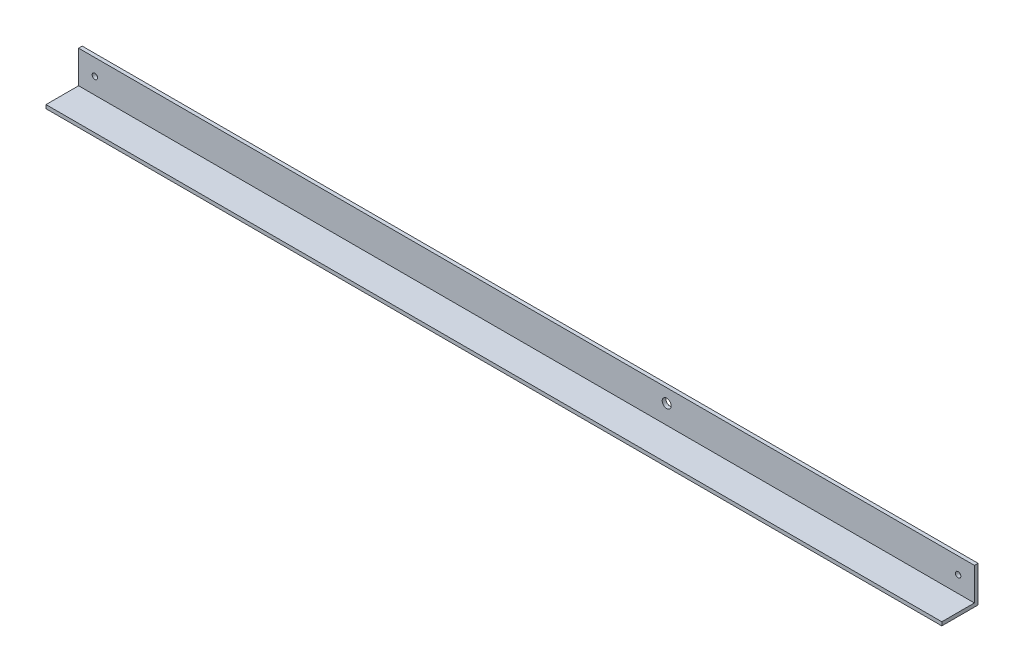
from build123d import *

# Parameters (mm, degrees)
BOSS_EXTRUDE1_DEPTH      = 170
BOSS_EXTRUDE1_DEPTH_BACK = 325
SKETCH3_R                = 2.5
SKETCH3_R_2              = 1.5
CUT_EXTRUDE1_DEPTH       = 2


with BuildPart() as part:
    # Sketch1 → Boss-Extrude1 (new, two sides: drawn at the far end of the back side and taken through both)
    with BuildSketch(Plane(origin=(0, 0, 0), x_dir=(0, 0, -1), z_dir=(1, 0, 0)).offset(-BOSS_EXTRUDE1_DEPTH_BACK)):
        Polygon((0, 20), (0, 0), (-20, 0), (-20, 2), (-2, 2), (-2, 20), align=None)
    extrude(amount=BOSS_EXTRUDE1_DEPTH + BOSS_EXTRUDE1_DEPTH_BACK)

    # Sketch3 → Cut-Extrude1 (cut)
    with BuildSketch(Plane.XY.offset(2)):
        with Locations((0, 12.5)):
            Circle(SKETCH3_R)
        with Locations((161, 11)):
            Circle(SKETCH3_R_2)
        with Locations((-316, 11)):
            Circle(SKETCH3_R_2)
    extrude(amount=-CUT_EXTRUDE1_DEPTH, mode=Mode.SUBTRACT)


solid = part.part
